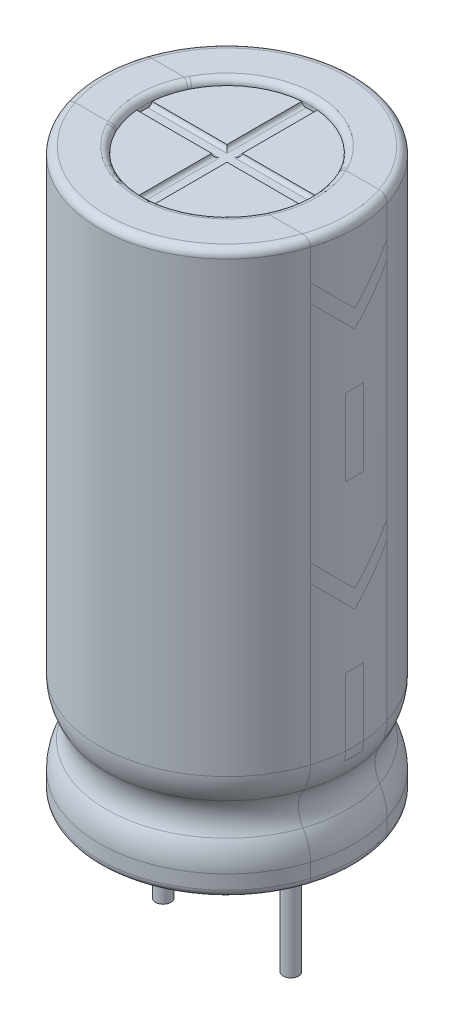
from build123d import *

# Parameters (mm, degrees)
SKETCH_2_R          = 3.25
CUT_EXTRUDE_1_DEPTH = 0.25
CUT_EXTRUDE_2_DEPTH = 0.15
FILLET_1_R          = 0.3
FILLET_2_R          = 2
CUT_EXTRUDE_START   = -0.25
SKETCH_4_R          = 3.25
CUT_EXTRUDE_3_DEPTH = 0.25
SKETCH_5_R          = 0.3
EXTRUDE_1_DEPTH     = 5
FILLET_3_R          = 0.15
FILLET_4_R          = 0.25
FILLET_5_R          = 0.2


with BuildPart() as part:
    # Эскиз1 → Повернуть2 (revolve)
    with BuildSketch(Plane.XY, mode=Mode.PRIVATE) as revolve_2_sk:
        with BuildLine():
            Line((0, 0), (-5, 0))
            Line((-5, 0), (-5, 1.539531364))
            ThreePointArc((-5, 1.539531364), (-4.55, 2.5), (-5, 3.460468636))
            Line((-5, 3.460468636), (-5, 22))
            Line((-5, 22), (0, 22))
            Line((0, 22), (0, 0))
        make_face()
    revolve(revolve_2_sk.sketch.rotate(Axis((0, 47.03836845, 0), (0, -1, 0)), 270), axis=Axis((0, 47.03836845, 0), (0, -1, 0)))

    # Эскиз2 → Вырез-Вытянуть1 (cut)
    with BuildSketch(Plane(origin=(0, 22, 0), x_dir=(1, 0, 0), z_dir=(0, 1, 0))):
        with Locations(Location((0, 0, 0), (0, 0, 270))):
            Circle(SKETCH_2_R)
    extrude(amount=-CUT_EXTRUDE_1_DEPTH, mode=Mode.SUBTRACT)

    # Эскиз3 → Вырез-Вытянуть2 (cut)
    with BuildSketch(Plane(origin=(0, 21.75, 0), x_dir=(1, 0, 0), z_dir=(0, 1, 0))):
        with BuildLine():
            Line((-0.3, 3.236124225), (-0.3, 0.3))
            Line((-0.3, 0.3), (-3.236124225, 0.3))
            ThreePointArc((-3.236124225, 0.3), (-3.25, 0), (-3.236124225, -0.3))
            Line((-3.236124225, -0.3), (-0.3, -0.3))
            Line((-0.3, -0.3), (-0.3, -3.236124225))
            ThreePointArc((-0.3, -3.236124225), (0, -3.25), (0.3, -3.236124225))
            Line((0.3, -3.236124225), (0.3, -0.3))
            Line((0.3, -0.3), (3.236124225, -0.3))
            ThreePointArc((3.236124225, -0.3), (3.25, 0), (3.236124225, 0.3))
            Line((3.236124225, 0.3), (0.3, 0.3))
            Line((0.3, 0.3), (0.3, 3.236124225))
            ThreePointArc((0.3, 3.236124225), (0, 3.25), (-0.3, 3.236124225))
        make_face()
    extrude(amount=-CUT_EXTRUDE_2_DEPTH, mode=Mode.SUBTRACT)

    # Скругление1
    fillet_1_edges = [part.edges().sort_by_distance(p)[0] for p in [
        (0, 0, -5),
        (0, 22, -5),
    ]]
    fillet(fillet_1_edges, radius=FILLET_1_R)

    # Скругление2
    fillet_2_edges = [part.edges().sort_by_distance(p)[0] for p in [
        (0, 1.539531364, -5),
        (0, 3.460468636, -5),
    ]]
    fillet(fillet_2_edges, radius=FILLET_2_R)

    # Эскиз4 → Вырез-Вытянуть3 (cut)
    with BuildSketch(Plane.XZ.offset(CUT_EXTRUDE_START)):
        with Locations(Location((0, 0, 0), (0, 0, 90))):
            Circle(SKETCH_4_R)
    extrude(amount=CUT_EXTRUDE_3_DEPTH, mode=Mode.SUBTRACT)

    # Эскиз5 → Бобышка-Вытянуть1 (add)
    with BuildSketch(Plane.XZ.offset(-0.25)):
        with Locations(Location((-2.5, 0, 0), (0, 0, 270))):
            Circle(SKETCH_5_R)
        with Locations(Location((2.5, 0, 0), (0, 0, 90))):
            Circle(SKETCH_5_R)
    extrude(amount=EXTRUDE_1_DEPTH)

    # Скругление3
    fillet_3_edges = [part.edges().sort_by_distance(p)[0] for p in [
        (0.3, 21.6, -1.768062113),
        (-1.768062113, 21.6, 0.3),
        (1.768062113, 21.6, 0.3),
        (0.3, 21.6, 1.768062113),
        (-0.3, 21.6, 1.768062113),
        (1.768062113, 21.6, -0.3),
        (-0.3, 21.6, -1.768062113),
        (-1.768062113, 21.6, -0.3),
    ]]
    fillet(fillet_3_edges, radius=FILLET_3_R - 0.0001)  # a hair under: the kernel refuses the full size

    # Скругление4
    fillet_4_edges = [part.edges().sort_by_distance(p)[0] for p in [
        (0, 22, -3.25),
    ]]
    fillet(fillet_4_edges, radius=FILLET_4_R - 0.0001)  # a hair under: the kernel refuses the full size

    # Скругление5
    fillet_5_edges = [part.edges().sort_by_distance(p)[0] for p in [
        (0, 0, -3.25),
        (0, 0, -3.25),
        (0, 0, -3.25),
        (0, 0, -3.25),
    ]]
    fillet(fillet_5_edges, radius=FILLET_5_R)


solid = part.part
